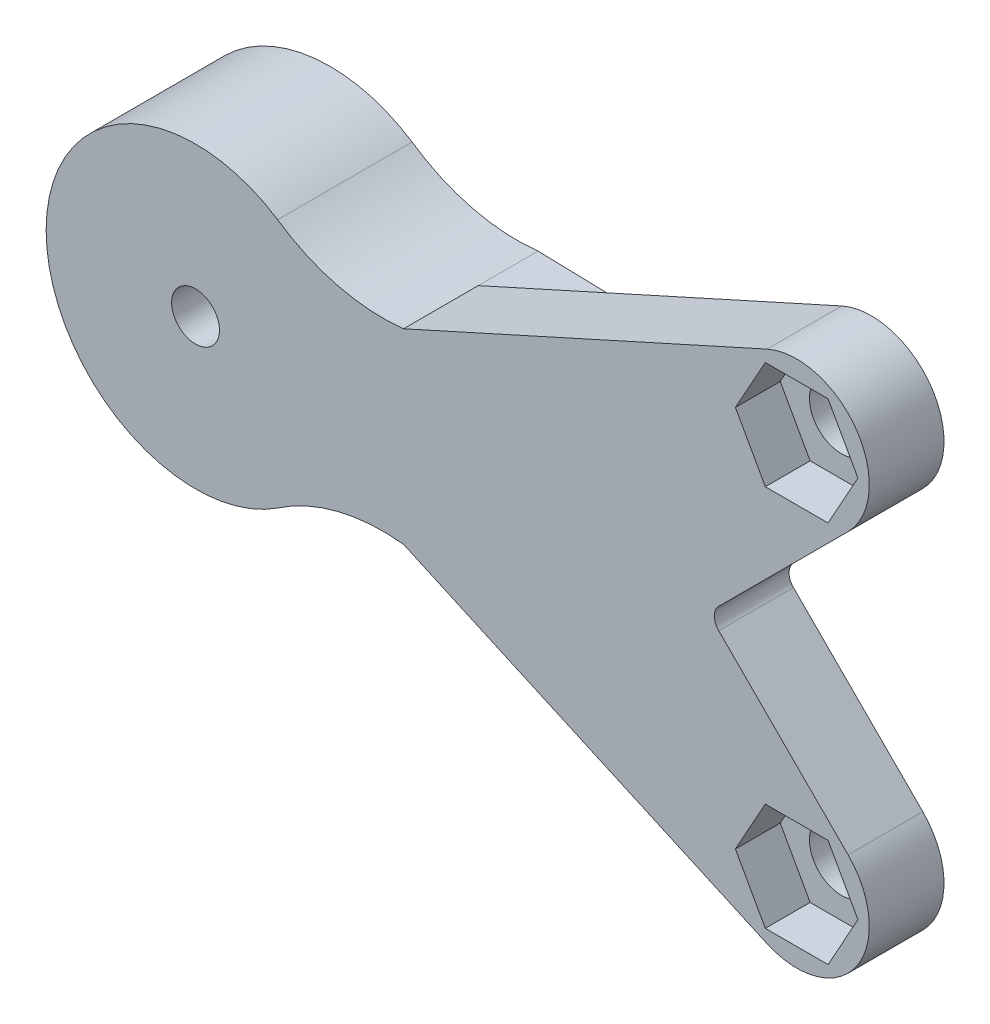
from build123d import *

# Parameters (mm, degrees)
BOSS_EXTRUDE1_DEPTH = 9
BOSS_EXTRUDE2_START = -5
SKETCH6_R           = 2.142705637
BOSS_EXTRUDE2_DEPTH = 5
CUT_EXTRUDE1_DEPTH  = 6
SKETCH9_R           = 1.6
CUT_EXTRUDE2_DEPTH  = 6
CUT_EXTRUDE3_DEPTH  = 3
FILLET1_R           = 1


with BuildPart() as part:
    # Sketch2 → Boss-Extrude1 (new body)
    with BuildSketch(Plane.XY):
        with BuildLine():
            Line((13.923486695, -6.250000093), (23.935808117, -6))
            ThreePointArc((23.935808117, -6), (29.935808117, 0), (23.935808117, 6))
            Line((23.935808117, 6), (13.923486695, 6.250000093))
            ThreePointArc((13.923486695, 6.250000093), (9.518581948, 6.542551177), (5.493579732, 8.355871093))
            ThreePointArc((5.493579732, 8.355871093), (-10, 0), (5.493579732, -8.355871093))
            ThreePointArc((5.493579732, -8.355871093), (9.518581948, -6.542551177), (13.923486695, -6.250000093))
        make_face()
    extrude(amount=BOSS_EXTRUDE1_DEPTH)

    # Sketch6 → Boss-Extrude2 (add)
    with BuildSketch(Plane.XY.offset(9).offset(BOSS_EXTRUDE2_START)):
        with BuildLine():
            Line((38.246061815, 17.232807658), (13.923486695, 6.250000093))
            Line((13.923486695, 6.250000093), (23.935808117, 6))
            ThreePointArc((23.935808117, 6), (28.178449102, 4.242640389), (29.935808117, -8.43e-07))
            ThreePointArc((29.935808117, -8.43e-07), (28.178448506, -4.242640985), (23.935808117, -6))
            Line((23.935808117, -6), (13.923486695, -6.250000093))
            Line((13.923486695, -6.250000093), (38.246061815, -17.232807658))
            ThreePointArc((38.246061815, -17.232807658), (42.874608669, -16.875896473), (45.091866788, -12.797343053))
            ThreePointArc((45.091866788, -12.797343053), (44.723394897, -10.941104168), (43.673854661, -9.366347162))
            Line((43.673854661, -9.366347162), (34.3075075, 0))
            Line((34.3075075, 0), (43.673854661, 9.366347162))
            ThreePointArc((43.673854661, 9.366347162), (44.723394897, 10.941104168), (45.091866788, 12.797343053))
            ThreePointArc((45.091866788, 12.797343053), (42.874608669, 16.875896473), (38.246061815, 17.232807658))
        make_face()
        with Locations((40.232073655, -12.797343053)):
            Circle(SKETCH6_R, mode=Mode.SUBTRACT)
        with Locations((40.232073655, 12.797343053)):
            Circle(SKETCH6_R, mode=Mode.SUBTRACT)
    extrude(amount=BOSS_EXTRUDE2_DEPTH)

    # Sketch7 → Cut-Extrude1 (cut)
    with BuildSketch(Plane(origin=(0, 0, 0), x_dir=(-1, 0, 0), z_dir=(0, 0, -1))):
        with BuildLine():
            ThreePointArc((17.881488686, -2.43711799), (19.982635496, 0.030860156), (17.881488686, 2.498838303))
            Line((17.881488686, 2.498838303), (8.401819085, 4.030860156))
            Line((8.401819085, 4.030860156), (3.901819085, 4.030860156))
            ThreePointArc((3.901819085, 4.030860156), (-0.017364504, 5.630860156), (-3.936548092, 4.030860156))
            Line((-3.936548092, 4.030860156), (-8.436548092, 4.030860156))
            Line((-8.436548092, 4.030860156), (-17.916217693, 2.498838303))
            ThreePointArc((-17.916217693, 2.498838303), (-20.017364504, 0.030860156), (-17.916217693, -2.43711799))
            Line((-17.916217693, -2.43711799), (-8.436548092, -3.969139844))
            Line((-8.436548092, -3.969139844), (-3.936548092, -3.969139844))
            ThreePointArc((-3.936548092, -3.969139844), (-0.017364504, -5.569139844), (3.901819085, -3.969139844))
            Line((3.901819085, -3.969139844), (8.401819085, -3.969139844))
            Line((8.401819085, -3.969139844), (17.881488686, -2.43711799))
        make_face()
    extrude(amount=-CUT_EXTRUDE1_DEPTH, mode=Mode.SUBTRACT)

    # Sketch9 → Cut-Extrude2 (cut)
    with BuildSketch(Plane(origin=(0, 0, 6), x_dir=(-1, 0, 0), z_dir=(0, 0, -1))):
        Circle(SKETCH9_R)
    extrude(amount=-CUT_EXTRUDE2_DEPTH, mode=Mode.SUBTRACT)

    # Sketch10 → Cut-Extrude3 (cut)
    with BuildSketch(Plane.XY.offset(9)):
        Polygon((38.132073655, 9.197343053), (42.332073655, 9.197343053), (44.332073655, 12.797343053), (42.332073655, 16.397343053), (38.132073655, 16.397343053), (36.132073655, 12.797343053), align=None)
        Polygon((38.132073655, -9.197343053), (36.132073655, -12.797343053), (38.132073655, -16.397343053), (42.332073655, -16.397343053), (44.332073655, -12.797343053), (42.332073655, -9.197343053), align=None)
    extrude(amount=-CUT_EXTRUDE3_DEPTH, mode=Mode.SUBTRACT)

    # Fillet1
    fillet1_edges = [part.edges().sort_by_distance(p)[0] for p in [
        (34.3075075, 0, 6.5),
    ]]
    fillet(fillet1_edges, radius=FILLET1_R)


solid = part.part
